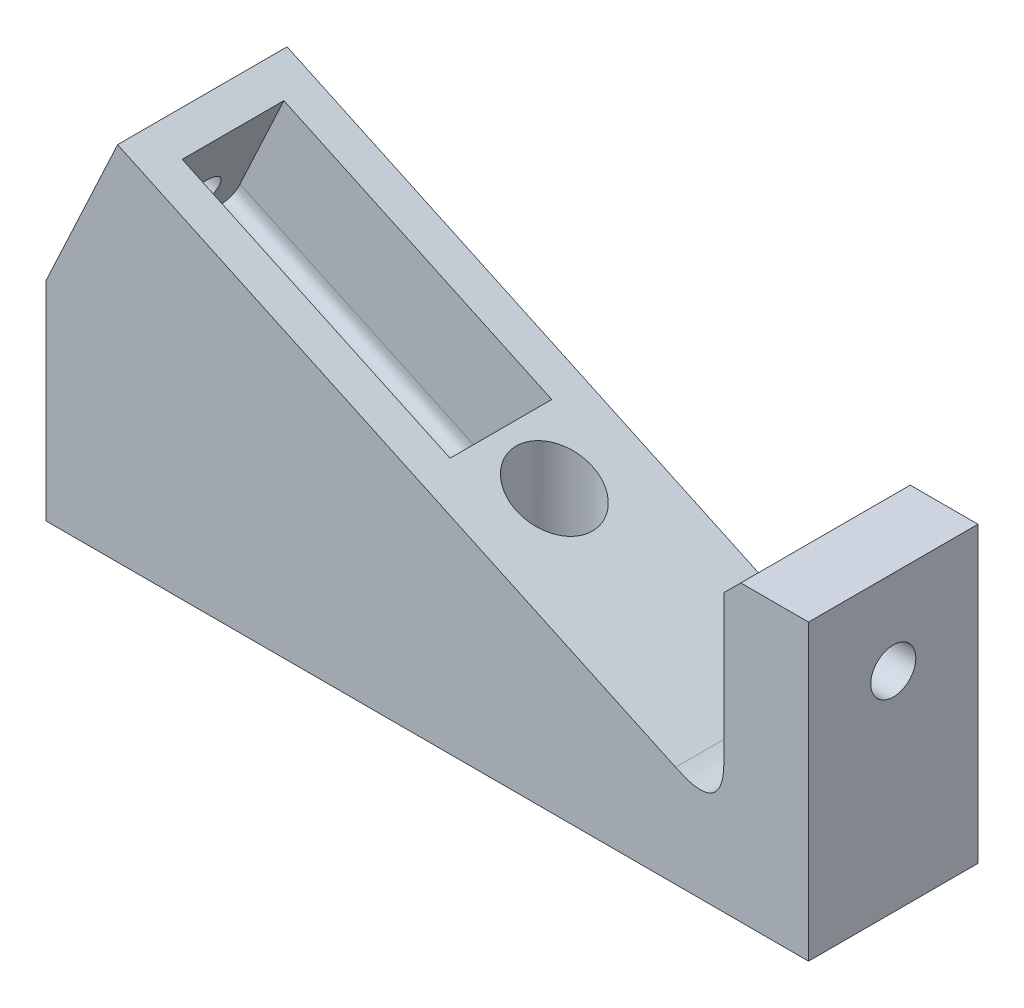
from build123d import *

# Parameters (mm, degrees)
BOSS_EXTRUDE2_DEPTH         = 12.7
CUT_EXTRUDE1_DEPTH          = 7.62
SKETCH3_R                   = 3.3
CUT_EXTRUDE3_DEPTH          = 5.08
FILLET1_START               = -124
FILLET1_DEPTH               = 45.095218809
FILLET1_START_2             = -7.62
FILLET1_2_DEPTH             = 16.62
FILLET1_3_DEPTH             = 46
F_1_4_CLEARANCE_HOLE1_D     = 6.7564
SKETCH8_R                   = 5.715
CUT_EXTRUDE4_DEPTH          = 137.313591586
CUT_EXTRUDE5_DEPTH          = 141.404698959
BOSS_EXTRUDE3_DEPTH         = 25.4
F_1_4_CLEARANCE_HOLE2_D     = 6.7564
F_1_4_CLEARANCE_HOLE2_DEPTH = 12.7
F_1_4_CLEARANCE_HOLE2_TIP   = 2.029827343
SKETCH14_R                  = 5.715
CUT_EXTRUDE6_DEPTH          = 6.604
CHAMFER1_SIZE               = 2.54


with BuildPart() as part:
    # Sketch1 → Boss-Extrude2 (new, symmetric)
    with BuildSketch(Plane.XY):
        Polygon((-127, 31.195273444), (-127, 0), (0, 0), (-116.265496152, 54.215491235), align=None)
    extrude(amount=BOSS_EXTRUDE2_DEPTH, both=True)

    # Sketch2 → Cut-Extrude1 (cut, symmetric)
    with BuildSketch(Plane.XY):
        Polygon((-115.634064254, 43.549297267), (-114.746565904, 45.45254362), (-109.127457625, 42.832310397), (-113.691734852, 33.044186297), (-119.310843131, 35.66441952), (-118.423344781, 37.567665873), align=None)
        Polygon((-71.512017628, 33.34660147), (-111.661452594, 52.068590465), (-114.746565904, 45.45254362), (-109.127457625, 42.832310397), (-113.691734852, 33.044186297), (-79.161408165, 16.942430525), align=None)
    extrude(amount=CUT_EXTRUDE1_DEPTH, both=True, mode=Mode.SUBTRACT)

    # Sketch3 → Cut-Extrude3 (cut)
    with BuildSketch(Plane(origin=(-116.265496152, 54.215491235, 0), x_dir=(0, 0, 1), z_dir=(-0.9063077870366528, 0.42261826174069317, 0))):
        with Locations(Location((0, -12.7, 0), (0, 0, 270))):
            Circle(SKETCH3_R)
    extrude(amount=-CUT_EXTRUDE3_DEPTH, mode=Mode.SUBTRACT)


with BuildPart() as fillet1_tool:
    # Fillet1: read off the stored shape, not the designer's step
    # Fillet1 outline → Fillet1 (new body)
    with BuildSketch(Plane(origin=(0, 0, 0), x_dir=(0.42261826174025074, 0.9063077870368592, -5.451523076012236e-13), z_dir=(0.9063077870368591, -0.42261826174025074, -1.1690828963840908e-12)).offset(FILLET1_START)):
        with BuildLine():
            Line((-18.1, 7.62), (-18.1, 5.08))
            add(Edge.make_bspline(
                [(-15.56, 7.62), (-15.987223051, 7.62), (-16.414446102, 7.62), (-17.356051224, 7.437902524), (-17.917902524, 6.876051224), (-18.1, 5.934446102), (-18.1, 5.507223051), (-18.1, 5.08)],
                knots=[0, 0, 0, 0, 0, 0, 0.5, 0.5, 1, 1, 1, 1, 1, 1], degree=5))
            Line((-15.56, 7.62), (-18.1, 7.62))
        make_face()
    extrude(amount=FILLET1_DEPTH)


with BuildPart() as part_1:
    add(part.part)


with BuildPart() as part_2:
    # Fillet1: joined with fillet1_tool
    add(part_1.part.fuse(fillet1_tool.part, tol=0.00001))


with BuildPart() as fillet1_2_tool:
    # Fillet1 2 outline → Fillet1 2 (new body)
    with BuildSketch(Plane.XY.offset(FILLET1_START_2)):
        with BuildLine():
            Line((-79.161408165, 16.942430525), (-78.087957781, 19.244452304))
            add(Edge.make_bspline(
                [(-78.087957781, 19.244452304), (-78.268510044, 18.857256726), (-78.449062307, 18.470061148), (-79.012038188, 17.693634812), (-79.758697015, 17.421873224), (-80.689038789, 17.654776383), (-81.076234367, 17.835328646), (-81.463429944, 18.015880909)],
                knots=[0, 0, 0, 0, 0, 0, 0.5, 0.5, 1, 1, 1, 1, 1, 1], degree=5))
            Line((-81.463429944, 18.015880909), (-79.161408165, 16.942430525))
        make_face()
    extrude(amount=FILLET1_2_DEPTH)


with BuildPart() as part_3:
    add(part_2.part)


with BuildPart() as part_4:
    # Fillet1 2: joined with fillet1_2_tool
    add(part_3.part.fuse(fillet1_2_tool.part, tol=0.00001))


with BuildPart() as fillet1_3_tool:
    # Fillet1 3 outline → Fillet1 3 (new body)
    with BuildSketch(Plane(origin=(0, 0, 0), x_dir=(0.42261826174025074, 0.9063077870368592, -5.451523076012236e-13), z_dir=(0.9063077870368591, -0.42261826174025074, -1.1690828963840908e-12)).offset(FILLET1_START)):
        with BuildLine():
            Line((-14, -7.62), (-15.56, -7.62))
            add(Edge.make_bspline(
                [(-15.56, -7.62), (-15.987223051, -7.62), (-16.414446102, -7.62), (-17.356051224, -7.437902524), (-17.917902524, -6.876051224), (-18.1, -5.934446102), (-18.1, -5.507223051), (-18.1, -5.08)],
                knots=[0, 0, 0, 0, 0, 0, 0.5, 0.5, 1, 1, 1, 1, 1, 1], degree=5))
            Line((-18.1, -5.08), (-18.1, -4))
            Line((-18.1, -4), (-20, -4))
            Line((-20, -4), (-20, -9))
            Line((-20, -9), (-14, -9))
            Line((-14, -9), (-14, -7.62))
        make_face()
    extrude(amount=FILLET1_3_DEPTH)


with BuildPart() as part_5:
    add(part_4.part)


with BuildPart() as part_6:
    # Fillet1 3: joined with fillet1_3_tool
    add(part_5.part.fuse(fillet1_3_tool.part, tol=0.00001))

    # 1/4 Clearance Hole1 (through all)
    with Locations(Plane(origin=(0, 0, 0), x_dir=(-1, 0, 0), z_dir=(0, -1, 0))):
        with Locations((63.5, 0)):
            Hole(F_1_4_CLEARANCE_HOLE1_D / 2)

    # Sketch8 → Cut-Extrude4 (cut, through all)
    with BuildSketch(Plane(origin=(0, 6.35, 0), x_dir=(-1, 0, 0), z_dir=(0, -1, 0))):
        with Locations(Location((63.5, 0, 0), (0, 0, 90))):
            Circle(SKETCH8_R)
    extrude(amount=-CUT_EXTRUDE4_DEPTH, mode=Mode.SUBTRACT)

    # Sketch9 → Cut-Extrude5 (cut, through all)
    with BuildSketch(Plane.XY.offset(12.7)):
        Polygon((-12.7, 5.922107259), (-12.7, 0), (0, 0), align=None)
    extrude(amount=-CUT_EXTRUDE5_DEPTH, mode=Mode.SUBTRACT)

    # Sketch10 → Boss-Extrude3 (add)
    with BuildSketch(Plane.XY.offset(12.7)):
        Polygon((-12.7, 5.922107259), (-12.7, 44.022107259), (-25.4, 44.022107259), (-25.4, 11.844214517), align=None)
    extrude(amount=-BOSS_EXTRUDE3_DEPTH)

    # 1/4 Clearance Hole2
    with Locations(Plane(origin=(-12.7, 0, 0), x_dir=(0, 0, -1), z_dir=(1, 0, 0))):
        with Locations((0, 31.322107259)):
            Hole(F_1_4_CLEARANCE_HOLE2_D / 2, depth=F_1_4_CLEARANCE_HOLE2_DEPTH)
            with Locations((0, 0, -(F_1_4_CLEARANCE_HOLE2_DEPTH + F_1_4_CLEARANCE_HOLE2_TIP / 2))):  # 118° drill point
                Cone(0, F_1_4_CLEARANCE_HOLE2_D / 2, F_1_4_CLEARANCE_HOLE2_TIP, mode=Mode.SUBTRACT)

    # Sketch14 → Cut-Extrude6 (cut)
    with BuildSketch(Plane.ZY.offset(25.4)):
        with Locations(Location((0, 31.322107259, 0), (0, 0, 270))):
            Circle(SKETCH14_R)
    extrude(amount=-CUT_EXTRUDE6_DEPTH, mode=Mode.SUBTRACT)

    # Chamfer1
    chamfer1_edges = [part_6.edges().sort_by_distance(p)[0] for p in [
        (-25.4, 44.022107259, 0),
    ]]
    chamfer(chamfer1_edges, length=CHAMFER1_SIZE)

    # Fillet2
    # a fillet whose section is not a circle: 5.08 mm, written as the material it adds along each edge (its section moved 0.00015 mm through the faces so that the kernel can cut it)
    with BuildSketch(Plane(origin=(-25.4, 11.844214517, 12.7), x_dir=(1.881112974510357e-05, 0.9999999998230706, 0), z_dir=(0, 0, -1))) as fillet2_piece_1:
        with BuildLine():
            add(Edge.make_bspline([(7.974002733, 0), (6.748845081, 2.3047e-05), (5.523687428, 4.6093e-05), (2.911264627, -0.681700719), (1.848095837, -2.35047216), (2.334181059, -5.00626823), (2.851934169, -6.11664789), (3.369687279, -7.227027551)], knots=[0, 0, 0, 0, 0, 0, 0.5, 0.5, 1, 1, 1, 1, 1, 1], degree=5))
            Line((3.369687279, -7.227027551), (3.277605601, -7.269963835))
            ThreePointArc((3.277605601, -7.269963835), (1.592829935, -3.656418364), (-0.092081679, -0.042936283))
            Line((-0.092081679, -0.042936283), (1.911e-06, 0.1016))
            ThreePointArc((1.911e-06, 0.1016), (3.987003276, 0.101525), (7.974004644, 0.1016))
            Line((7.974004644, 0.1016), (7.974002733, 0))
        make_face()
    extrude(amount=25.4)


solid = part_6.part
